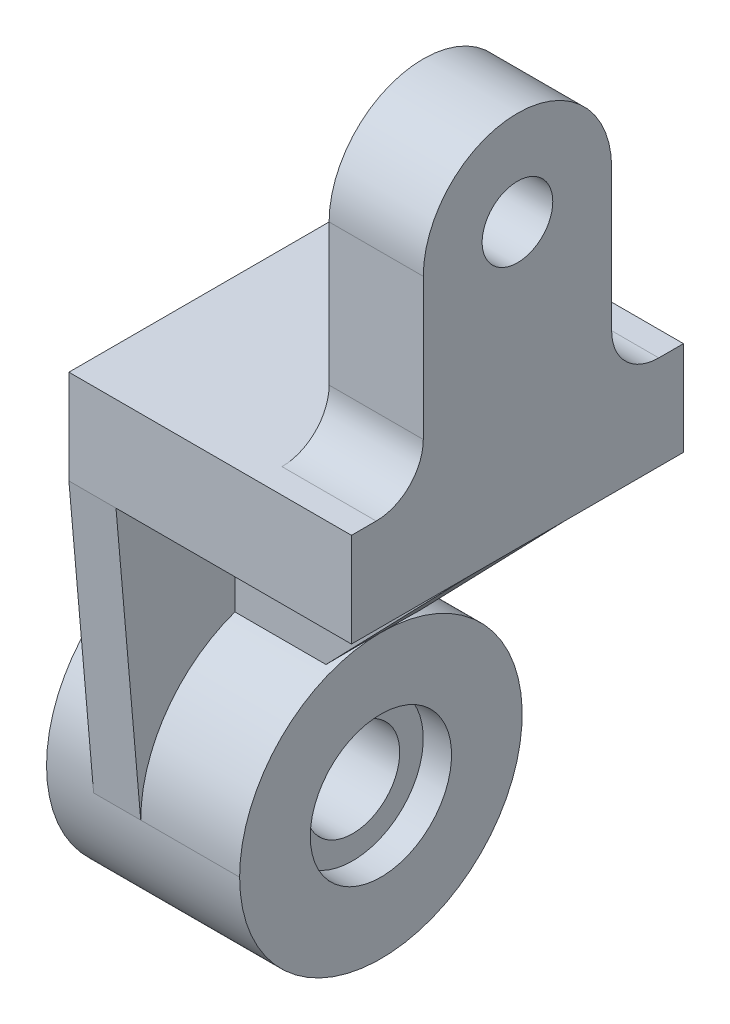
from build123d import *

# Parameters (mm, degrees)
SKETCH3_W                = 60
SKETCH3_H                = 70.5
BOSS_EXTRUDE1_DEPTH      = 20
SKETCH4_R                = 7.5
BOSS_EXTRUDE2_DEPTH      = 20
BOSS_EXTRUDE3_DEPTH      = 10
BOSS_EXTRUDE3_DEPTH_BACK = 31
SKETCH5_R                = 15
BOSS_EXTRUDE4_DEPTH      = 10
BOSS_EXTRUDE6_DEPTH      = 4
BOSS_EXTRUDE6_DEPTH_BACK = 25
SKETCH5_5_R              = 15
SKETCH5_5_R_2            = 10
RIB1_REACH               = 106.607
SKETCH6_WALL_W           = 252.938699882
SKETCH6_WALL_H           = 20


with BuildPart() as part:
    # Sketch3 → Boss-Extrude1 (new body)
    with BuildSketch(Plane(origin=(0, 0, 0), x_dir=(1, 0, 0), z_dir=(0, 1, 0))):
        Rectangle(SKETCH3_W, SKETCH3_H)
    extrude(amount=BOSS_EXTRUDE1_DEPTH)

    # Sketch4 → Boss-Extrude2 (add)
    with BuildSketch(Plane(origin=(30, 0, 0), x_dir=(0, 0, -1), z_dir=(1, 0, 0))):
        with BuildLine():
            Line((20, 60), (20, 30))
            ThreePointArc((20, 30), (22.928932188, 22.928932188), (30, 20))
            Line((30, 20), (-30, 20))
            ThreePointArc((-30, 20), (-22.928932188, 22.928932188), (-20, 30))
            Line((-20, 30), (-20, 60))
            ThreePointArc((-20, 60), (0, 80), (20, 60))
        make_face()
        with Locations((0, 60)):
            Circle(SKETCH4_R, mode=Mode.SUBTRACT)
    extrude(amount=-BOSS_EXTRUDE2_DEPTH)



with BuildPart() as body_2:
    # Sketch5 → Boss-Extrude3 (new, two sides: drawn at the far end of the back side and taken through both)
    with BuildSketch(Plane.ZY.offset(30).offset(-BOSS_EXTRUDE3_DEPTH_BACK)):
        with BuildLine():
            ThreePointArc((-30, -60), (0, -90), (30, -60))
            ThreePointArc((30, -60), (0, -30), (-30, -60))
        make_face()
        with Locations((0, -60)):
            Circle(SKETCH5_R, mode=Mode.SUBTRACT)
    extrude(amount=BOSS_EXTRUDE3_DEPTH + BOSS_EXTRUDE3_DEPTH_BACK)


with BuildPart() as part_1:
    add(part.part)

    add(body_2.part)  # Boss-Extrude4 merges body 2
    # Sketch5<3> → Boss-Extrude4 (add)
    with BuildSketch(Plane.ZY.offset(30)):
        with BuildLine():
            Line((35.25, 0), (-35.25, 0))
            Line((-35.25, 0), (-30, -60))
            ThreePointArc((-30, -60), (0, -30), (30, -60))
            Line((30, -60), (35.25, 0))
        make_face()
    extrude(amount=-BOSS_EXTRUDE4_DEPTH)

    # Sketch5<5> → Boss-Extrude6 (add, two sides: drawn at the far end of the back side and taken through both)
    with BuildSketch(Plane.ZY.offset(30).offset(-BOSS_EXTRUDE6_DEPTH_BACK)):
        with Locations((0, -60)):
            Circle(SKETCH5_5_R)
        with Locations((0, -60)):
            Circle(SKETCH5_5_R_2, mode=Mode.SUBTRACT)
    extrude(amount=BOSS_EXTRUDE6_DEPTH + BOSS_EXTRUDE6_DEPTH_BACK)

    # Sketch6 wall → Rib1 (add, up to next)
    with BuildSketch(Plane(origin=(15.5, -15, 0), x_dir=(-0.695022096847, -0.718988376049, 0), z_dir=(0.718988376049, -0.695022096847, 0)), mode=Mode.PRIVATE) as rib1_sk1:
        Rectangle(SKETCH6_WALL_W, SKETCH6_WALL_H)
    rib1_tool1 = extrude(rib1_sk1.sketch, amount=-RIB1_REACH, mode=Mode.PRIVATE) - part_1.part
    add(rib1_tool1.solids().sort_by_distance((15.5, -15, 0))[0])


solid = part_1.part
